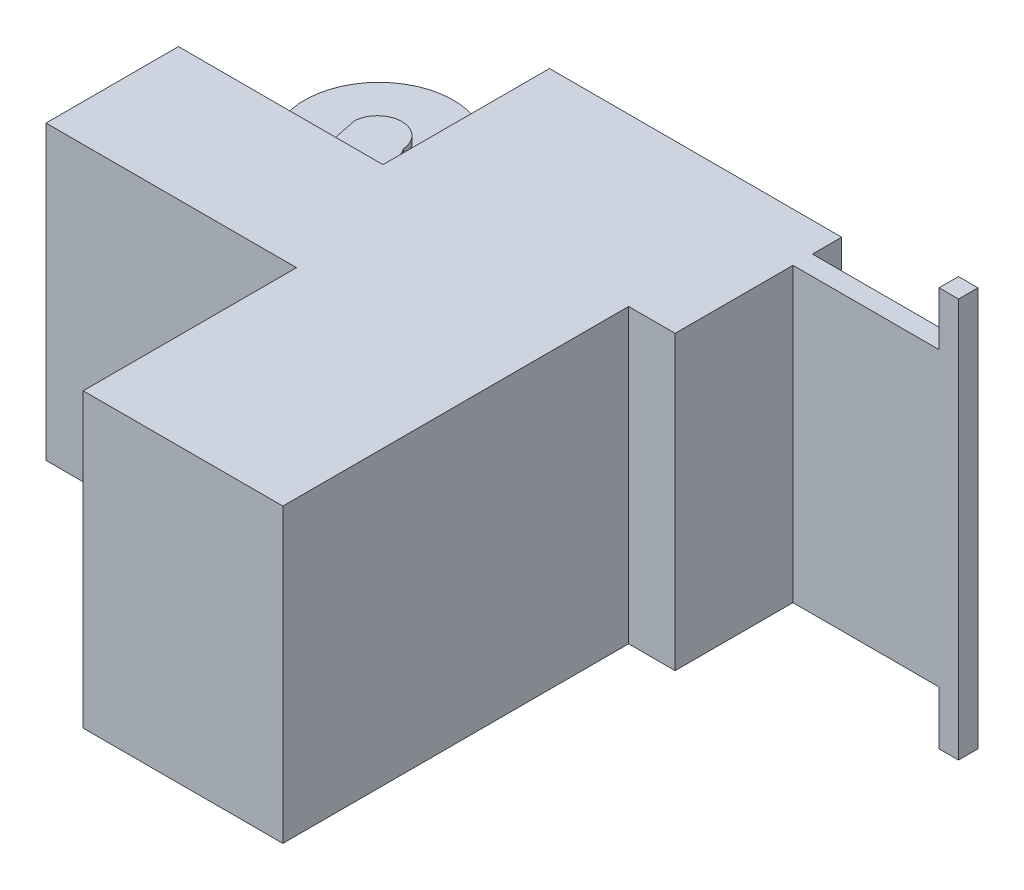
from build123d import *

# Parameters (mm, degrees)
SKETCH_1_W          = 300
SKETCH_1_H          = 171
EXTRUDE_1_DEPTH     = 300
SKETCH_2_W          = 205.00000064
SKETCH_2_H          = 300
EXTRUDE_2_DEPTH     = 355
SKETCH_3_W          = 300
SKETCH_3_H          = 136
EXTRUDE_3_DEPTH     = 257.21007636
EXTRUDE_4_DEPTH     = 24
EXTRUDE_5_DEPTH     = 120
EXTRUDE_7_DEPTH     = 62
CUT_EXTRUDE_3_DEPTH = 133
EXTRUDE_9_DEPTH     = 62
CUT_EXTRUDE_4_DEPTH = 7.5
CUT_EXTRUDE_START   = -7.5
CUT_EXTRUDE_5_DEPTH = 7.5
SKETCH_13_W         = 300
SKETCH_13_H         = 20
EXTRUDE_10_DEPTH    = 170
SKETCH_14_W         = 20
SKETCH_14_H         = 20
EXTRUDE_11_DEPTH    = 55
SKETCH_15_W         = 20
SKETCH_15_H         = 20
EXTRUDE_13_DEPTH    = 55
MOVE_BODY_2_ANGLE   = 90


with BuildPart() as part:
    # ｽｹｯﾁ1 → ﾎﾞｽ - 押し出し1 (new body)
    with BuildSketch(Plane(origin=(0, 0, 0), x_dir=(0, 0, -1), z_dir=(1, 0, 0))):
        with Locations((105.647745135, 53.288865182)):
            Rectangle(SKETCH_1_W, SKETCH_1_H)
    extrude(amount=EXTRUDE_1_DEPTH)

    # ｽｹｯﾁ2 → ﾎﾞｽ - 押し出し2 (add)
    with BuildSketch(Plane(origin=(0, 138.788865182, 0), x_dir=(1, 0, 0), z_dir=(0, 1, 0))):
        with Locations((149.71007668, 105.647745135)):
            Rectangle(SKETCH_2_W, SKETCH_2_H)
    extrude(amount=EXTRUDE_2_DEPTH)

    # ｽｹｯﾁ3 → ﾎﾞｽ - 押し出し3 (add)
    with BuildSketch(Plane.ZY.offset(-47.21007636)):
        with Locations((-105.647745135, 206.788865182)):
            Rectangle(SKETCH_3_W, SKETCH_3_H)
    extrude(amount=EXTRUDE_3_DEPTH)

    # ｽｹｯﾁ4 → ﾎﾞｽ - 押し出し4 (add)
    with BuildSketch(Plane.XZ.offset(-138.788865182)):
        Polygon((-141.96039145, -105.647745135), (-141.96039145, -45.647745135), (-21.96039145, -45.647745135), (-21.96039145, -165.647745135), (-141.96039145, -165.647745135), align=None)
    extrude(amount=EXTRUDE_4_DEPTH)

    # ｽｹｯﾁ5 → ﾎﾞｽ - 押し出し5 (add)
    with BuildSketch(Plane.XZ.offset(-114.788865182)):
        Polygon((-141.96039145, -105.647745135), (-141.96039145, -136.647745135), (-21.96039145, -136.647745135), (-21.96039145, -74.647745135), (-141.96039145, -74.647745135), align=None)
    extrude(amount=EXTRUDE_5_DEPTH)

    # ｽｹｯﾁ6 → ﾎﾞｽ - 押し出し7 (add)
    with BuildSketch(Plane(origin=(0, 0, -136.647745135), x_dir=(-1, 0, 0), z_dir=(0, 0, -1))):
        with BuildLine():
            Line((81.96039145, 114.788865182), (122.64268945, -4.366639057))
            ThreePointArc((122.64268945, -4.366639057), (147.64268945, -28.265469922), (172.64268945, -4.366639057))
            Line((172.64268945, -4.366639057), (147.64268945, 114.788865182))
            Line((147.64268945, 114.788865182), (81.96039145, 114.788865182))
        make_face()
    extrude(amount=-EXTRUDE_7_DEPTH)

    # ｽｹｯﾁ8 → ｶｯﾄ - 押し出し3 (cut)
    with BuildSketch(Plane(origin=(0, 0, -136.647745135), x_dir=(-1, 0, 0), z_dir=(0, 0, -1))):
        Polygon((122.695062033, -5.211134818), (55.539135991, 114.788865182), (21.96039145, 114.788865182), (21.96039145, -5.211134818), align=None)
    extrude(amount=-CUT_EXTRUDE_3_DEPTH, mode=Mode.SUBTRACT)

    # ｽｹｯﾁ13 → ﾎﾞｽ - 押し出し10 (add)
    with BuildSketch(Plane(origin=(300, 0, 0), x_dir=(0, 0, -1), z_dir=(1, 0, 0))):
        with Locations((105.647745135, 7.788865182)):
            Rectangle(SKETCH_13_W, SKETCH_13_H)
    extrude(amount=EXTRUDE_10_DEPTH)

    # ｽｹｯﾁ14 → ﾎﾞｽ - 押し出し11 (add)
    with BuildSketch(Plane.XY.offset(44.352254865)):
        with Locations((460, 7.788865182)):
            Rectangle(SKETCH_14_W, SKETCH_14_H)
    extrude(amount=EXTRUDE_11_DEPTH)

    # ｽｹｯﾁ15 → ﾎﾞｽ - 押し出し13 (add)
    with BuildSketch(Plane(origin=(0, 0, -255.647745135), x_dir=(-1, 0, 0), z_dir=(0, 0, -1))):
        with Locations((-460, 7.788865182)):
            Rectangle(SKETCH_15_W, SKETCH_15_H)
    extrude(amount=EXTRUDE_13_DEPTH)


with BuildPart() as body_2:
    # ｽｹｯﾁ9 → ﾎﾞｽ - 押し出し9 (new body)
    with BuildSketch(Plane(origin=(0, 0, -136.647745135), x_dir=(-1, 0, 0), z_dir=(0, 0, -1))):
        with BuildLine():
            ThreePointArc((172.64268945, -4.366639057), (148.065748541, -28.261893715), (122.695062033, -5.211134818))
            Line((122.695062033, -5.211134818), (92.689876472, 48.40471831))
            ThreePointArc((92.689876472, 48.40471831), (118.977792145, -75.704835229), (224.168875741, -4.788886938))
            ThreePointArc((224.168875741, -4.788886938), (204.898385478, 45.975600801), (156.795458346, 71.164753462))
            Line((156.795458346, 71.164753462), (172.64268945, -4.366639057))
        make_face()
    extrude(amount=-EXTRUDE_9_DEPTH)

    # ｽｹｯﾁ11 → ｶｯﾄ - 押し出し4 (cut)
    with BuildSketch(Plane(origin=(0, 0, -136.647745135), x_dir=(-1, 0, 0), z_dir=(0, 0, -1))):
        with BuildLine():
            Line((156.795458346, 71.164753462), (172.64268945, -4.366639057))
            ThreePointArc((172.64268945, -4.366639057), (148.065748541, -28.261893715), (122.695062033, -5.211134818))
            Line((122.695062033, -5.211134818), (92.689876472, 48.40471831))
            ThreePointArc((92.689876472, 48.40471831), (173.264106323, -76.880038763), (156.795458346, 71.164753462))
        make_face()
    extrude(amount=-CUT_EXTRUDE_4_DEPTH, mode=Mode.SUBTRACT)

    # ｽｹｯﾁ12 → ｶｯﾄ - 押し出し5 (cut)
    with BuildSketch(Plane.XY.offset(-74.647745135).offset(CUT_EXTRUDE_START)):
        with BuildLine():
            Line((-156.795458346, 71.164753462), (-172.64268945, -4.366639057))
            ThreePointArc((-172.64268945, -4.366639057), (-148.065748541, -28.261893715), (-122.695062033, -5.211134818))
            Line((-122.695062033, -5.211134818), (-92.689876472, 48.40471831))
            ThreePointArc((-92.689876472, 48.40471831), (-173.264106323, -76.880038763), (-156.795458346, 71.164753462))
        make_face()
    extrude(amount=CUT_EXTRUDE_5_DEPTH, mode=Mode.SUBTRACT)


with BuildPart() as part_1:
    # Move Body 2: moved
    add(part.part.rotate(Axis((0, 112.863399222, -105.647745135), (1, 0, 0)), MOVE_BODY_2_ANGLE))


with BuildPart() as body_2_1:
    # Move Body 2: moved
    add(body_2.part.rotate(Axis((0, 112.863399222, -105.647745135), (1, 0, 0)), MOVE_BODY_2_ANGLE))


with BuildPart() as part_2:
    # Move Body 3: moved
    add(part_1.part.moved(Location((-212, -150, 38))))


with BuildPart() as body_2_2:
    # Move Body 3: moved
    add(body_2_1.part.moved(Location((-212, -150, 38))))


solid = Compound([part_2.part, body_2_2.part])
